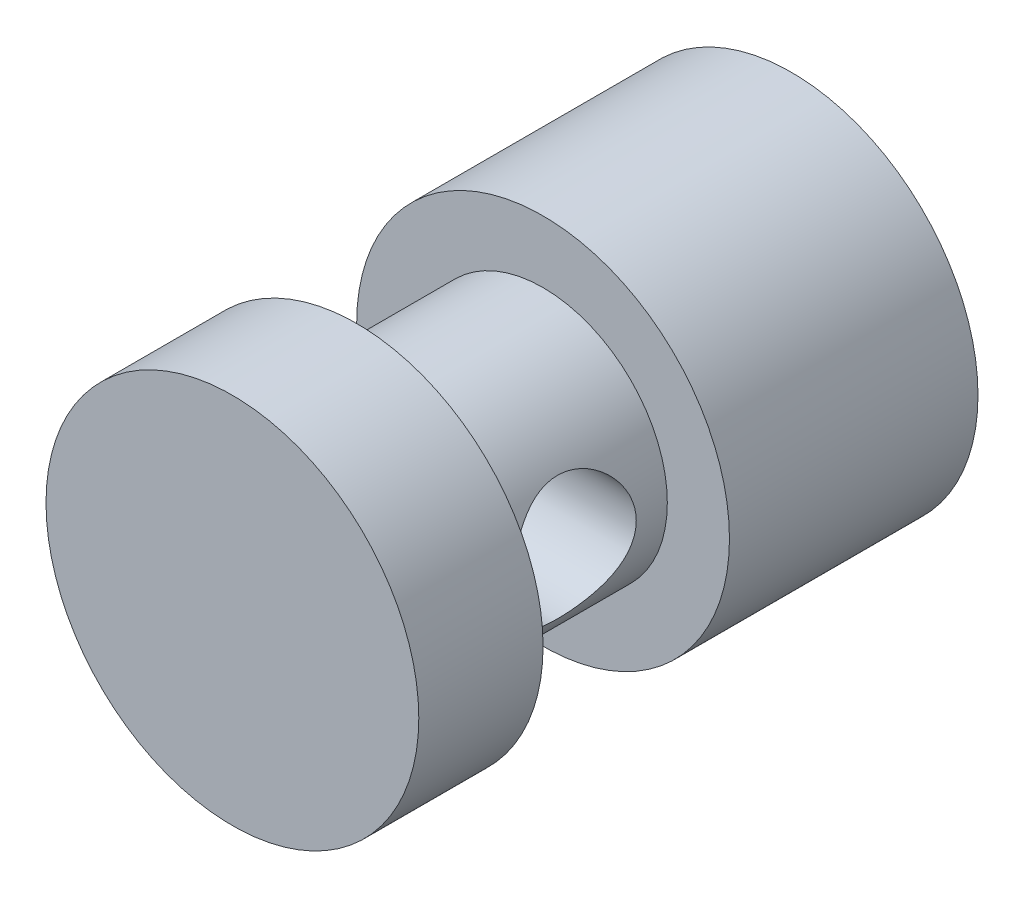
from build123d import *

# Parameters (mm, degrees)
SKETCH_2_R          = 3
EXTRUDE_1_DEPTH     = 4
SKETCH_3_R          = 2
EXTRUDE_2_DEPTH     = 3
SKETCH_4_R          = 1
CUT_EXTRUDE_1_DEPTH = 10.110433579
SKETCH_5_R          = 3
EXTRUDE_3_DEPTH     = 2


with BuildPart() as part:
    # 草图2 → 凸台-拉伸1 (new body)
    with BuildSketch(Plane.XY):
        Circle(SKETCH_2_R)
    extrude(amount=EXTRUDE_1_DEPTH)

    # 草图3 → 凸台-拉伸2 (add)
    with BuildSketch(Plane.XY.offset(4)):
        Circle(SKETCH_3_R)
    extrude(amount=EXTRUDE_2_DEPTH)

    # 草图4 → 切除-拉伸1 (cut, through all)
    with BuildSketch(Plane(origin=(2, 0, 0), x_dir=(0, 0, -1), z_dir=(1, 0, 0))):
        with Locations((-5.5, 0)):
            Circle(SKETCH_4_R)
    extrude(amount=-CUT_EXTRUDE_1_DEPTH, mode=Mode.SUBTRACT)

    # 草图5 → 凸台-拉伸3 (add)
    with BuildSketch(Plane.XY.offset(7)):
        Circle(SKETCH_5_R)
    extrude(amount=EXTRUDE_3_DEPTH)


solid = part.part
